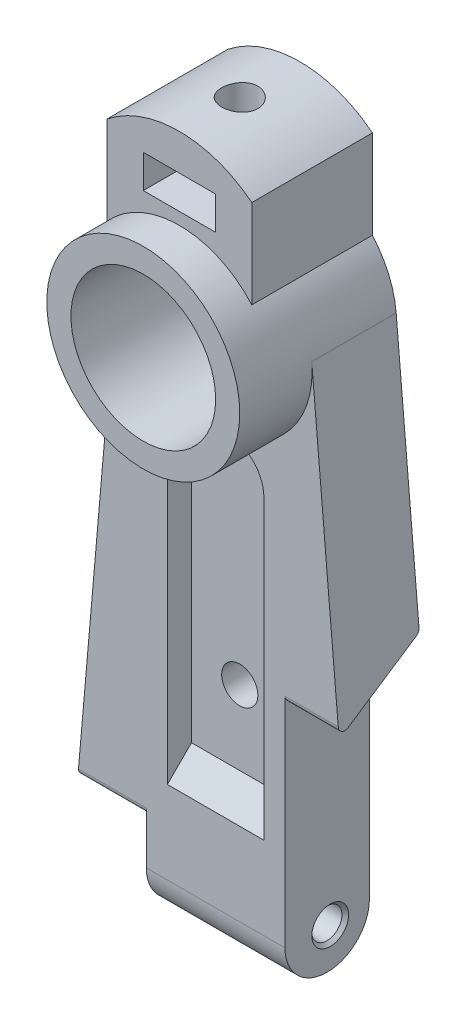
from build123d import *

# Parameters (mm, degrees)
SKETCH1_R                = 1
BOSS_EXTRUDE1_DEPTH      = 5.75
BOSS_EXTRUDE2_DEPTH      = 6.5
BOSS_EXTRUDE2_DEPTH_BACK = 3.5
SKETCH3_W                = 6
SKETCH3_H                = 2.75
BOSS_EXTRUDE3_DEPTH      = 9.5
BOSS_EXTRUDE3_DEPTH_BACK = 3.5
SKETCH3_5_R              = 8
SKETCH3_5_R_2            = 6
CUT_EXTRUDE1_DEPTH       = 36.96265424
CUT_EXTRUDE1_DEPTH_BACK  = 36.96265424
SKETCH3_6_R              = 6
SKETCH3_6_R_2            = 1.5
CUT_EXTRUDE3_START       = 1.5
SKETCH3_8_R              = 1.5
CUT_EXTRUDE3_DEPTH       = 2
FILLET1_R                = 3
CHAMFER1_SIZE            = 2
BOSS_EXTRUDE4_DEPTH      = 3.5
CUT_EXTRUDE5_DEPTH       = 4.494021888
CUT_EXTRUDE6_DEPTH       = 5.692616578
FILLET2_R                = 0.5
CUT_EXTRUDE8_DEPTH       = 57.979942817
CUT_EXTRUDE8_DEPTH_BACK  = 10
SKETCH11_R               = 1.5
LPATTERN1_COUNT          = 2
LPATTERN1_PITCH          = 5
SKETCH14_R               = 1
BOSS_EXTRUDE5_DEPTH      = 11.5


with BuildPart() as part:
    # Sketch1 → Boss-Extrude1 (new, symmetric)
    with BuildSketch(Plane(origin=(0, 0, 0), x_dir=(0, 0, -1), z_dir=(1, 0, 0))):
        with BuildLine():
            Line((-3.5, 19), (3.5, 19))
            Line((3.5, 19), (3.5, -23.51))
            ThreePointArc((3.5, -23.51), (0, -27.01), (-3.5, -23.51))
            Line((-3.5, -23.51), (-3.5, 19))
        make_face()
        with Locations((0.25, -23.76)):
            Circle(SKETCH1_R, mode=Mode.SUBTRACT)
    extrude(amount=BOSS_EXTRUDE1_DEPTH, both=True)



with BuildPart() as body_2:
    # Sketch3 → Boss-Extrude2 (new, two sides: drawn at the far end of the back side and taken through both)
    with BuildSketch(Plane.XY.offset(-BOSS_EXTRUDE2_DEPTH_BACK)):
        with BuildLine():
            ThreePointArc((-6, 24.291502622), (0, 27), (6, 24.291502622))
            Line((6, 24.291502622), (6, 31.641502622))
            ThreePointArc((6, 31.641502622), (0, 33.75), (-6, 31.641502622))
            Line((-6, 31.641502622), (-6, 24.291502622))
        make_face()
        with Locations((0, 29.375)):
            Rectangle(SKETCH3_W, SKETCH3_H, mode=Mode.SUBTRACT)
    extrude(amount=BOSS_EXTRUDE2_DEPTH + BOSS_EXTRUDE2_DEPTH_BACK)


with BuildPart() as part_1:
    add(part.part)

    add(body_2.part)  # Boss-Extrude3 merges body 2
    # Sketch3<5> → Boss-Extrude3 (add, two sides: drawn at the far end of the back side and taken through both)
    with BuildSketch(Plane.XY.offset(-BOSS_EXTRUDE3_DEPTH_BACK)):
        with Locations((0, 19)):
            Circle(SKETCH3_5_R)
        with Locations((0, 19)):
            Circle(SKETCH3_5_R_2, mode=Mode.SUBTRACT)
    extrude(amount=BOSS_EXTRUDE3_DEPTH + BOSS_EXTRUDE3_DEPTH_BACK)

    # Sketch3<6> → Cut-Extrude1 (cut, two sides: drawn at the far end of the back side and taken through both)
    with BuildSketch(Plane.XY.offset(-CUT_EXTRUDE1_DEPTH_BACK)):
        with Locations((0, 19)):
            Circle(SKETCH3_6_R)
        with Locations((0, -8.5)):
            Circle(SKETCH3_6_R_2)
    extrude(amount=CUT_EXTRUDE1_DEPTH + CUT_EXTRUDE1_DEPTH_BACK, mode=Mode.SUBTRACT)

    # Sketch3<8> → Cut-Extrude3 (cut)
    with BuildSketch(Plane.XY.offset(CUT_EXTRUDE3_START)):
        Polygon((4, -14.65), (4, 11), (0, 11), (-4, 11), (-4, -14.65), align=None)
        with Locations((0, -8.5)):
            Circle(SKETCH3_8_R, mode=Mode.SUBTRACT)
    extrude(amount=CUT_EXTRUDE3_DEPTH, mode=Mode.SUBTRACT)

    # Fillet1
    fillet1_edges = [part_1.edges().sort_by_distance(p)[0] for p in [
        (4, 11, 2.5),
        (-4, 11, 2.5),
    ]]
    fillet(fillet1_edges, radius=FILLET1_R)

    # Chamfer1
    chamfer1_edges = [part_1.edges().sort_by_distance(p)[0] for p in [
        (0, -14.65, 3.5),
    ]]
    chamfer(chamfer1_edges, length=CHAMFER1_SIZE - 0.0001)  # a hair under: the kernel refuses the full size

    # Sketch6 → Boss-Extrude4 (add, symmetric)
    with BuildSketch(Plane.XY):
        with BuildLine():
            Line((-5.75, -20), (-5.75, 13.437851135))
            ThreePointArc((-5.75, 13.437851135), (-7.539998072, 16.32634537), (-7.969557585, 19.697245942))
            Line((-7.969557585, 19.697245942), (-11.442616578, -20))
            Line((-11.442616578, -20), (-5.75, -20))
        make_face()
        with BuildLine():
            ThreePointArc((5.75, 13.437851135), (7.539998072, 16.32634537), (7.969557585, 19.697245942))
            Line((7.969557585, 19.697245942), (10.244021888, -6.3))
            Line((10.244021888, -6.3), (5.75, -6.3))
            Line((5.75, -6.3), (5.75, 13.437851135))
        make_face()
    extrude(amount=BOSS_EXTRUDE4_DEPTH, both=True)

    # Sketch8 → Cut-Extrude5 (cut)
    with BuildSketch(Plane(origin=(10.244021888, 0, 0), x_dir=(0, 0, -1), z_dir=(1, 0, 0))):
        Polygon((-3.5, -6.3), (3.5, -2.258548116), (3.5, -6.3), align=None)
    extrude(amount=-CUT_EXTRUDE5_DEPTH, mode=Mode.SUBTRACT)

    # Sketch9 → Cut-Extrude6 (cut)
    with BuildSketch(Plane.ZY.offset(11.442616578)):
        Polygon((-3.5, -20), (-3.5, -16.735846393), (3.5, -20), align=None)
    extrude(amount=-CUT_EXTRUDE6_DEPTH, mode=Mode.SUBTRACT)

    # Fillet2
    fillet2_edges = [part_1.edges().sort_by_distance(p)[0] for p in [
        (-8.596308289, -20, 3.5),
        (7.997010944, -6.3, 3.5),
        (7.820220332, -2.258548116, -3.5),
        (-8.453520071, -16.735846393, -3.5),
    ]]
    fillet(fillet2_edges, radius=FILLET2_R)

    # Sketch11 → Cut-Extrude8 (cut, two sides: drawn at the far end of the back side and taken through both)
    with BuildSketch(Plane(origin=(0, 28, 0), x_dir=(1, 0, 0), z_dir=(0, 1, 0)).offset(-CUT_EXTRUDE8_DEPTH_BACK)):
        with Locations(Location((0, -1.5, 0), (0, 0, 270))):
            Circle(SKETCH11_R)
    extrude(amount=CUT_EXTRUDE8_DEPTH + CUT_EXTRUDE8_DEPTH_BACK, mode=Mode.SUBTRACT)

    # Sketch13 → M3 Tapped Hole1 (revolve, cut)
    with BuildSketch(Plane(origin=(-9.619215273, 0.841572288, 0), x_dir=(-0.08715574274765137, -0.9961946980917462, 0), z_dir=(0, 0, 1))):
        Polygon((0, 0), (0, 7.851075774), (1.25, 7.1), (1.25, 0.275), (1.525, 0), align=None)
    m3_tapped_hole1 = revolve(axis=Axis((-15.945051605, 1.395011255, 0), (0.996194698091746, -0.08715574274765134, 0)), mode=Mode.SUBTRACT)

    # LPattern1: M3 Tapped Hole1 ×2
    with Locations(*[Vector(-0.08715574274765112, -0.9961946980917462, 0) * (i * LPATTERN1_PITCH) for i in range(1, LPATTERN1_COUNT)]):
        add(m3_tapped_hole1, mode=Mode.SUBTRACT)

    # Sketch14 → Boss-Extrude5 (add)
    with BuildSketch(Plane.ZY.offset(5.75)):
        with Locations((-0.25, -23.76)):
            Circle(SKETCH14_R)
    extrude(amount=-BOSS_EXTRUDE5_DEPTH)

    # Sketch16 → M3 Tapped Hole2 (revolve, cut)
    with BuildSketch(Plane(origin=(-5.75, -23.76, -0.25), x_dir=(0, 0, 1), z_dir=(0, 1, 0))):
        Polygon((0, 0), (0, 11.5), (1.525, 11.5), (1.25, 11.225), (1.25, 0.275), (1.525, 0), align=None)
    revolve(axis=Axis((-12.1, -23.76, -0.25), (1, 0, 0)), mode=Mode.SUBTRACT)


solid = part_1.part
